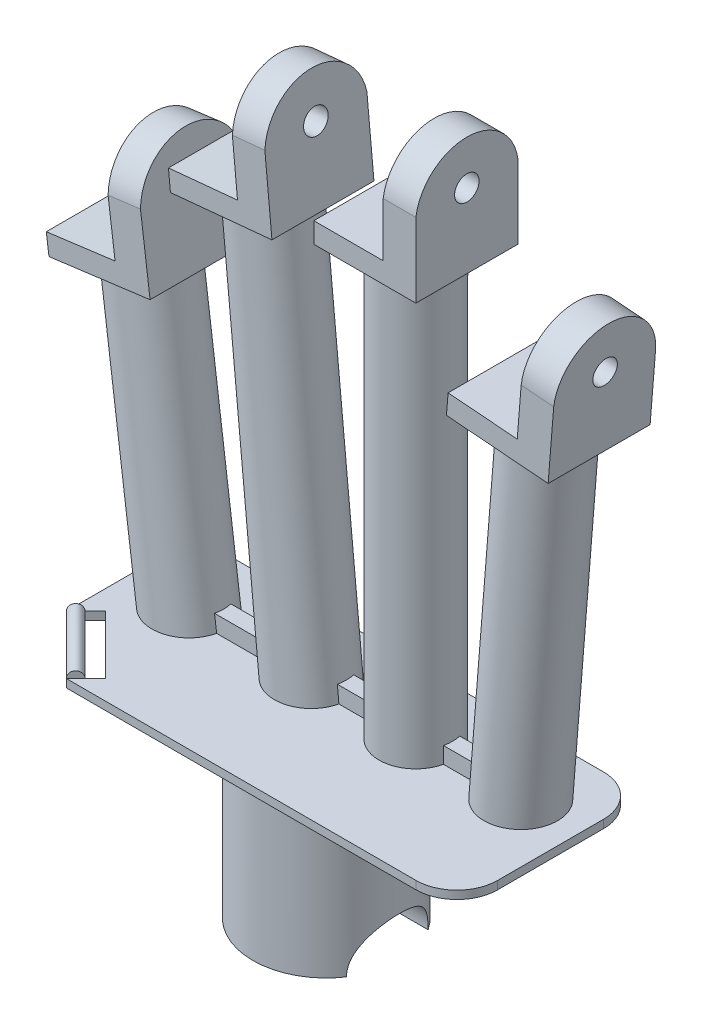
from build123d import *
from build123d.topology import SkipClean

# Parameters (mm, degrees)
BOSS_EXTRUDE1_DEPTH       = 2
CUT_EXTRUDE4_DEPTH        = 10
SKETCH6_W                 = 2
SKETCH6_H                 = 14.5
CUT_EXTRUDE5_DEPTH        = 10
SKETCH7_W                 = 12.5
SKETCH7_H                 = 12.5
BOSS_EXTRUDE2_DEPTH       = 2.5
SKETCH8_W                 = 2
SKETCH8_H                 = 2
BOSS_EXTRUDE3_DEPTH       = 41.5
CUT_EXTRUDE6_DEPTH        = 41.5
SKETCH10_W                = 2
SKETCH10_H                = 2
BOSS_EXTRUDE4_DEPTH       = 50.5
CUT_EXTRUDE7_DEPTH        = 50.5
SKETCH12_W                = 12.5
SKETCH12_H                = 12.5
BOSS_EXTRUDE5_DEPTH       = 2.5
CUT_EXTRUDE8_DEPTH        = 60.477411679
CUT_EXTRUDE8_DEPTH_BACK   = 2.5
SKETCH14_W                = 12.5
SKETCH14_H                = 12.5
BOSS_EXTRUDE6_DEPTH       = 2.5
SKETCH15_W                = 2
SKETCH15_H                = 2
BOSS_EXTRUDE7_DEPTH       = 39.5
SKETCH16_W                = 12.5
SKETCH16_H                = 12.5
BOSS_EXTRUDE8_DEPTH       = 2.5
SKETCH17_W                = 2
SKETCH17_H                = 12.5
BOSS_EXTRUDE9_DEPTH       = 2.5
SKETCH18_W                = 2
SKETCH18_H                = 12.5
CUT_EXTRUDE9_DEPTH        = 13.5
SKETCH19_W                = 2
SKETCH19_H                = 2
BOSS_EXTRUDE10_DEPTH      = 7.5
CUT_EXTRUDE11_DEPTH       = 33.5
CUT_EXTRUDE12_DEPTH       = 33.5
SKETCH22_W                = 2
SKETCH22_H                = 2
BOSS_EXTRUDE11_DEPTH      = 35.5
BOSS_EXTRUDE13_DEPTH      = 4
BOSS_EXTRUDE14_DEPTH      = 4
BOSS_EXTRUDE15_DEPTH      = 4
BOSS_EXTRUDE16_DEPTH      = 4
SKETCH28_R                = 4.5
SKETCH28_W                = 2
SKETCH28_H                = 2
BOSS_EXTRUDE17_DEPTH      = 57
SKETCH29_R                = 4.5
SKETCH29_W                = 2
SKETCH29_H                = 2
BOSS_EXTRUDE18_DEPTH      = 57
SKETCH30_R                = 4.5
SKETCH30_W                = 2
SKETCH30_H                = 2
BOSS_EXTRUDE19_DEPTH      = 57
SKETCH31_R                = 4.5
SKETCH31_W                = 2
SKETCH31_H                = 2
BOSS_EXTRUDE20_DEPTH      = 57
SKETCH32_W                = 122.959633523
SKETCH32_H                = 42.81362782
CUT_EXTRUDE13_DEPTH       = 57
BOSS_EXTRUDE21_DEPTH      = 1
CUT_EXTRUDE14_DEPTH       = 8
CUT_EXTRUDE15_DEPTH       = 8
CUT_EXTRUDE16_DEPTH       = 8
CUT_EXTRUDE17_DEPTH       = 8
BOSS_EXTRUDE22_DEPTH      = 1
BOSS_EXTRUDE23_DEPTH      = 2
BOSS_EXTRUDE23_DEPTH_BACK = 2
BOSS_EXTRUDE24_DEPTH      = 4
BOSS_EXTRUDE25_DEPTH      = 12.5
CUT_EXTRUDE18_DEPTH       = 12.5
SKETCH43_W                = 16
SKETCH43_H                = 2
CUT_EXTRUDE19_DEPTH       = 8.5
SKETCH44_R                = 1.5
CUT_EXTRUDE20_DEPTH       = 8.5
SKETCH45_R                = 9
BOSS_EXTRUDE27_DEPTH      = 20
CUT_EXTRUDE23_START       = -30
SKETCH50_R                = 9
CUT_EXTRUDE23_DEPTH       = 65
CUT_EXTRUDE24_DEPTH       = 65
CUT_EXTRUDE24_DEPTH_BACK  = 65
SKETCH52_W                = 56.65762051
SKETCH52_H                = 44.736687233
CUT_EXTRUDE25_DEPTH       = 65
CUT_EXTRUDE25_DEPTH_BACK  = 65
CUT_EXTRUDE26_DEPTH       = 65
CUT_EXTRUDE26_DEPTH_BACK  = 65
SKETCH56_R                = 43.614088274
SKETCH56_R_2              = 5
SKETCH57_R                = 5
CUT_EXTRUDE27_DEPTH       = 65
CUT_EXTRUDE28_DEPTH       = 17
CUT_EXTRUDE28_DEPTH_BACK  = 38
SKETCH58_R                = 5
CUT_EXTRUDE29_DEPTH       = 38
CUT_EXTRUDE30_DEPTH       = 38
CUT_EXTRUDE30_DEPTH_BACK  = 38
CUT_EXTRUDE31_DEPTH       = 38
CUT_EXTRUDE31_DEPTH_BACK  = 38
SKETCH61_W                = 51.924996509
SKETCH61_H                = 129.765980517
SKETCH61_W_2              = 87.26427603
SKETCH61_H_2              = 70.94781342
CUT_EXTRUDE32_DEPTH       = 38
CUT_EXTRUDE32_DEPTH_BACK  = 38
SKETCH62_W                = 45.730105884
SKETCH62_H                = 47.620660458
SKETCH63_W                = 49.77831918
SKETCH63_H                = 37.549123937
CUT_EXTRUDE33_DEPTH       = 38
CUT_EXTRUDE34_DEPTH       = 10
CUT_EXTRUDE34_DEPTH_BACK  = 23
SKETCH64_R                = 5
BOSS_EXTRUDE28_START      = -1.2
BOSS_EXTRUDE28_DEPTH      = 10.1
BOSS_EXTRUDE30_DEPTH      = 10.1
SKETCH67_W                = 0.773681874
SKETCH67_H                = 1.279774778
CUT_EXTRUDE35_DEPTH       = 10.1
CUT_EXTRUDE38_DEPTH       = 6
CUT_EXTRUDE38_DEPTH_BACK  = 6
CUT_EXTRUDE38_START       = -20
CUT_EXTRUDE44_DEPTH       = 28
CUT_EXTRUDE44_DEPTH_BACK  = 28
SKETCH73_R                = 0.815
BOSS_EXTRUDE31_DEPTH      = 10.1
CUT_EXTRUDE45_DEPTH       = 10.1


with BuildPart() as part:
    # Sketch4 → Boss-Extrude1 (new body)
    with BuildSketch(Plane.XY):
        Polygon((-2, 0), (-9, 0), (-15.226290525, 65), (-17.226290525, 65), (-11, 0), (-18, 0), (-24.539432883, 50), (-26.539432883, 50), (-20, 0), (-26, 0), (-26, -2), (15, -2), (15, 0), (9, 0), (13.425952869, 55), (11.425952869, 55), (7, 0), (0, 0), (0, 65), (-2, 65), align=None)
    extrude(amount=BOSS_EXTRUDE1_DEPTH)

    # Sketch5 → Cut-Extrude4 (cut)
    with BuildSketch(Plane.XY.offset(2)):
        Polygon((9.37564634, 55.872220493), (11.411691477, 54.822777915), (13.398823363, 54.662869695), (21.924639112, 53.976781356), (22.692490212, 57.613912627), (5.524505056, 72.3940809), (-16.325209023, 68.104380376), (-29.665618302, 62.849218827), (-29.083331676, 48.976254453), (-26.450573674, 49.320589338), (-24.484209654, 49.577767448), (-21.099856707, 50.020402427), (-24.484209654, 55.686609511), (-20.205422124, 64.224167275), (-17.179736544, 64.513994928), (-15.197920791, 64.703831246), (-10.585008306, 65.145697912), (2.587624418, 67.202095486), align=None)
    extrude(amount=-CUT_EXTRUDE4_DEPTH, mode=Mode.SUBTRACT)

    # Sketch6 → Cut-Extrude5 (cut)
    with BuildSketch(Plane.XY.offset(2)):
        Polygon((-22.603788855, 35.200214888), (-24.484209654, 49.577767448), (-26.450573674, 49.320589338), (-24.570152875, 34.943036778), align=None)
        Polygon((-13.815307691, 50.26989966), (-15.197920791, 64.703831246), (-17.179736544, 64.513994928), (-15.797123444, 50.080063343), align=None)
        with Locations((-1, 57.75)):
            Rectangle(SKETCH6_W, SKETCH6_H)
        Polygon((13.398823363, 54.662869695), (11.411691477, 54.822777915), (10.248609178, 40.369500101), (12.235741065, 40.209591881), align=None)
    extrude(amount=-CUT_EXTRUDE5_DEPTH, mode=Mode.SUBTRACT)

    # Sketch7 → Boss-Extrude2 (add)
    with BuildSketch(Plane(origin=(0, 50.5, 0), x_dir=(1, 0, 0), z_dir=(0, 1, 0))):
        with Locations((-1, -1)):
            Rectangle(SKETCH7_W, SKETCH7_H)
    extrude(amount=BOSS_EXTRUDE2_DEPTH)

    # Sketch8 → Boss-Extrude3 (add)
    with BuildSketch(Plane(origin=(3.293647576, 40.929178869, 0), x_dir=(0.9967777802722212, -0.08021257230374512, 0), z_dir=(0.08021257230374512, 0.9967777802722212, 0))):
        with Locations((11.977444462, -1)):
            Rectangle(SKETCH8_W, SKETCH8_H)
    extrude(amount=-BOSS_EXTRUDE3_DEPTH)

    # Sketch9 → Cut-Extrude6 (cut)
    with BuildSketch(Plane.XY.offset(2)):
        Polygon((7, 0), (9, 0), (12.235741065, 40.209591881), (10.248609178, 40.369500101), align=None)
    extrude(amount=-CUT_EXTRUDE6_DEPTH, mode=Mode.SUBTRACT)

    # Sketch10 → Boss-Extrude4 (add)
    with BuildSketch(Plane(origin=(-4.897136804, 51.124163089, 0), x_dir=(0.995443557626006, 0.09535262755100443, 0), z_dir=(-0.09535262755100443, 0.995443557626006, 0))):
        with Locations((-13.958992019, -1)):
            Rectangle(SKETCH10_W, SKETCH10_H)
    extrude(amount=-BOSS_EXTRUDE4_DEPTH)

    # Sketch11 → Cut-Extrude7 (cut)
    with BuildSketch(Plane.XY.offset(2)):
        Polygon((-11, 0), (-9, 0), (-13.815307691, 50.26989966), (-15.797123444, 50.080063343), align=None)
    extrude(amount=-CUT_EXTRUDE7_DEPTH, mode=Mode.SUBTRACT)

    # Sketch12 → Boss-Extrude5 (add)
    with BuildSketch(Plane(origin=(3.293647576, 40.929178869, 0), x_dir=(0.9967777802722212, -0.08021257230374557, 0), z_dir=(0.08021257230374557, 0.9967777802722213, 0))):
        with Locations((11.977444462, -1)):
            Rectangle(SKETCH12_W, SKETCH12_H)
    extrude(amount=BOSS_EXTRUDE5_DEPTH)

    # Sketch13 → Cut-Extrude8 (cut, two sides: drawn at the far end of the back side and taken through both)
    with BuildSketch(Plane.XY.offset(2).offset(-CUT_EXTRUDE8_DEPTH_BACK)):
        Polygon((-17.606376667, 47.897602035), (-17.797081922, 49.88848915), (-19.787969037, 49.697783895), (-19.637893395, 48.131053798), (-19.615531264, 47.897602035), (-19.597263782, 47.70689678), align=None)
    extrude(amount=CUT_EXTRUDE8_DEPTH + CUT_EXTRUDE8_DEPTH_BACK, mode=Mode.SUBTRACT)

    # Sketch14 → Boss-Extrude6 (add)
    with BuildSketch(Plane(origin=(-4.706431548, 49.133275974, 0), x_dir=(0.995443557626006, 0.0953526275510043, 0), z_dir=(-0.0953526275510043, 0.995443557626006, 0))):
        with Locations((-13.958992019, -1)):
            Rectangle(SKETCH14_W, SKETCH14_H)
    extrude(amount=BOSS_EXTRUDE6_DEPTH)



with BuildPart() as body_2:
    # Sketch15 → Boss-Extrude7 (new body)
    with BuildSketch(Plane(origin=(-4.906512673, 37.514817884, 0), x_dir=(0.9915553489661718, 0.12968419308679568, 0), z_dir=(-0.12968419308679568, 0.9915553489661719, 0))):
        with Locations((-30.847996281, -1)):
            Rectangle(SKETCH15_W, SKETCH15_H)
    extrude(amount=-BOSS_EXTRUDE7_DEPTH)

    # Sketch16 → Boss-Extrude8 (add)
    with BuildSketch(Plane(origin=(-4.906512673, 37.514817884, 0), x_dir=(0.9915553489661718, 0.1296841930867958, 0), z_dir=(-0.1296841930867958, 0.9915553489661719, 0))):
        with Locations((-30.847996281, -1)):
            Rectangle(SKETCH16_W, SKETCH16_H)
    extrude(amount=BOSS_EXTRUDE8_DEPTH)

    # Sketch17 → Boss-Extrude9 (add)
    with BuildSketch(Plane(origin=(-5.230723156, 39.993706257, 0), x_dir=(0.9915553489661718, 0.12968419308679563, 0), z_dir=(-0.12968419308679563, 0.9915553489661718, 0))):
        with Locations((-23.597996281, -1)):
            Rectangle(SKETCH17_W, SKETCH17_H)
    extrude(amount=-BOSS_EXTRUDE9_DEPTH)

    # Sketch18 → Cut-Extrude9 (cut)
    with BuildSketch(Plane(origin=(-5.230723156, 39.993706257, 0), x_dir=(0.9915553489661718, 0.12968419308679563, 0), z_dir=(-0.12968419308679563, 0.9915553489661718, 0))):
        with Locations((-36.097996281, -1)):
            Rectangle(SKETCH18_W, SKETCH18_H)
    extrude(amount=-CUT_EXTRUDE9_DEPTH, mode=Mode.SUBTRACT)


with BuildPart() as part_1:
    add(part.part)

    add(body_2.part)  # Boss-Extrude10 merges body 2
    # Sketch19 → Boss-Extrude10 (add)
    with BuildSketch(Plane.ZY.offset(26)):
        with Locations((1, -1)):
            Rectangle(SKETCH19_W, SKETCH19_H)
    extrude(amount=BOSS_EXTRUDE10_DEPTH)

    # Sketch20 → Cut-Extrude11 (cut)
    with BuildSketch(Plane.XY.offset(2)):
        Polygon((-31.857654672, -2), (-29.840621531, -2), (-29.379927415, -5.522431713), (-31.363038113, -5.781800099), align=None)
        Polygon((-20, 0), (-18, 0), (-22.603788855, 35.200214888), (-24.570152875, 34.943036778), align=None)
    extrude(amount=-CUT_EXTRUDE11_DEPTH, mode=Mode.SUBTRACT)

    # Sketch21 → Cut-Extrude12 (cut)
    with BuildSketch(Plane.XY.offset(2)):
        Polygon((-36.48556374, 33.384636185), (-34.502453042, 33.644004571), (-30.102198846, 0), (-32.119231987, 0), align=None)
    extrude(amount=-CUT_EXTRUDE12_DEPTH, mode=Mode.SUBTRACT)


with BuildPart() as cut_extrude12_piece_1:
    # of the separate pieces the step leaves, piece 1, a body of its own (cut_extrude12_pieces)
    add(part_1.part.solids().sort_by_distance((-15.027463791, 0, 0))[0])



with BuildPart() as cut_extrude12_piece_2:
    # of the separate pieces the step leaves, piece 2, a body of its own (cut_extrude12_pieces)
    add(part_1.part.solids().sort_by_distance((-40.032329107, 35.44205093, -5.25))[0])


with BuildPart() as cut_extrude12_piece_1_1:
    add(cut_extrude12_piece_1.part)

    add(cut_extrude12_piece_2.part)  # Boss-Extrude11 merges Cut-Extrude12 piece 2
    # Sketch22 → Boss-Extrude11 (add)
    with BuildSketch(Plane(origin=(-4.906512673, 37.514817884, 0), x_dir=(-0.9915553489661718, -0.12968419308679563, 0), z_dir=(0.12968419308679563, -0.9915553489661718, 0))):
        with Locations((28.847996281, -1)):
            Rectangle(SKETCH22_W, SKETCH22_H)
    extrude(amount=BOSS_EXTRUDE11_DEPTH)

    # Sketch24 → Boss-Extrude13 (add)
    with BuildSketch(Plane(origin=(18.168711631, -1.462070207, 0), x_dir=(0, 0, -1), z_dir=(0.9967777802722213, -0.08021257230374557, 0))):
        with BuildLine():
            Line((5.25, 43.561488006), (5.25, 49.561488006))
            ThreePointArc((5.25, 49.561488006), (-1, 55.538239219), (-7.25, 49.561488006))
            Line((-7.25, 49.561488006), (-7.25, 43.561488006))
            Line((-7.25, 43.561488006), (5.25, 43.561488006))
        make_face()
    extrude(amount=-BOSS_EXTRUDE13_DEPTH)

    # Sketch25 → Boss-Extrude14 (add)
    with BuildSketch(Plane(origin=(5.25, 0, 0), x_dir=(0, 0, -1), z_dir=(1, 0, 0))):
        with BuildLine():
            Line((-7.25, 53), (5.25, 53))
            Line((5.25, 53), (5.25, 59.612068966))
            ThreePointArc((5.25, 59.612068966), (-1, 65), (-7.25, 59.612068966))
            Line((-7.25, 59.612068966), (-7.25, 53))
        make_face()
    extrude(amount=-BOSS_EXTRUDE14_DEPTH)

    # Sketch26 → Boss-Extrude15 (add)
    with BuildSketch(Plane(origin=(-7.673866441, -0.735072645, 0), x_dir=(0, 0, -1), z_dir=(0.995443557626006, 0.0953526275510043, 0))):
        with BuildLine():
            Line((-7.25, 51.858173648), (5.25, 51.858173648))
            Line((5.25, 51.858173648), (5.25, 58.470242613))
            ThreePointArc((5.25, 58.470242613), (-1, 63.858173648), (-7.25, 58.470242613))
            Line((-7.25, 58.470242613), (-7.25, 51.858173648))
        make_face()
    extrude(amount=-BOSS_EXTRUDE15_DEPTH)

    # Sketch27 → Boss-Extrude16 (add)
    with BuildSketch(Plane(origin=(-22.407164089, -2.930602913, 0), x_dir=(0, 0, -1), z_dir=(0.9915553489661718, 0.12968419308679563, 0))):
        with BuildLine():
            Line((-7.25, 40.334315476), (5.25, 40.334315476))
            Line((5.25, 40.334315476), (5.25, 46.946384441))
            ThreePointArc((5.25, 46.946384441), (-1, 52.334315476), (-7.25, 46.946384441))
            Line((-7.25, 46.946384441), (-7.25, 40.334315476))
        make_face()
    extrude(amount=-BOSS_EXTRUDE16_DEPTH)

    # Sketch28 → Boss-Extrude17 (add)
    with BuildSketch(Plane(origin=(0, 50.5, 0), x_dir=(-1, 0, 0), z_dir=(0, -1, 0))):
        with Locations((1, -1)):
            Circle(SKETCH28_R)
        with Locations((1, -1)):
            Rectangle(SKETCH28_W, SKETCH28_H, mode=Mode.SUBTRACT)
    extrude(amount=BOSS_EXTRUDE17_DEPTH)

    # Sketch29 → Boss-Extrude18 (add)
    with BuildSketch(Plane(origin=(-4.706431548, 49.133275974, 0), x_dir=(-0.995443557626006, -0.09535262755100447, 0), z_dir=(0.09535262755100449, -0.9954435576260061, 0))):
        with Locations((13.958992019, -1)):
            Circle(SKETCH29_R)
        with Locations((13.958992019, -1)):
            Rectangle(SKETCH29_W, SKETCH29_H, mode=Mode.SUBTRACT)
    extrude(amount=BOSS_EXTRUDE18_DEPTH)

    # Sketch30 → Boss-Extrude19 (add)
    with BuildSketch(Plane(origin=(-4.906512673, 37.514817884, 0), x_dir=(0.9915553489661718, 0.12968419308679563, 0), z_dir=(0.12968419308679563, -0.9915553489661718, 0))):
        with Locations((-28.847996281, 1)):
            Circle(SKETCH30_R)
        with Locations((-28.847996281, 1)):
            Rectangle(SKETCH30_W, SKETCH30_H, mode=Mode.SUBTRACT)
    extrude(amount=BOSS_EXTRUDE19_DEPTH)

    # Sketch31 → Boss-Extrude20 (add)
    with BuildSketch(Plane(origin=(3.293647576, 40.929178869, 0), x_dir=(-0.9967777802722212, 0.08021257230374572, 0), z_dir=(-0.0802125723037457, -0.9967777802722211, 0))):
        with Locations((-11.977444462, -1)):
            Circle(SKETCH31_R)
        with Locations((-11.977444462, -1)):
            Rectangle(SKETCH31_W, SKETCH31_H, mode=Mode.SUBTRACT)
    extrude(amount=BOSS_EXTRUDE20_DEPTH)

    # Sketch32 → Cut-Extrude13 (cut)
    with BuildSketch(Plane.XZ.offset(2)):
        with Locations((-20.029572383, 0.792189378)):
            Rectangle(SKETCH32_W, SKETCH32_H)
    extrude(amount=CUT_EXTRUDE13_DEPTH, mode=Mode.SUBTRACT)

    # Sketch33 → Boss-Extrude21 (add)
    with BuildSketch(Plane(origin=(0, -2, 0), x_dir=(-1, 0, 0), z_dir=(0, -1, 0))):
        with BuildLine():
            Line((-14.023148824, -9), (30.976851176, -9))
            ThreePointArc((30.976851176, -9), (34.512385082, -7.535533906), (35.976851176, -4))
            Line((35.976851176, -4), (35.976851176, 2))
            ThreePointArc((35.976851176, 2), (34.512385082, 5.535533906), (30.976851176, 7))
            Line((30.976851176, 7), (-14.023148824, 7))
            ThreePointArc((-14.023148824, 7), (-17.55868273, 5.535533906), (-19.023148824, 2))
            Line((-19.023148824, 2), (-19.023148824, -4))
            ThreePointArc((-19.023148824, -4), (-17.55868273, -7.535533906), (-14.023148824, -9))
        make_face()
    extrude(amount=BOSS_EXTRUDE21_DEPTH)

    # Sketch34 → Cut-Extrude14 (cut)
    with BuildSketch(Plane(origin=(-26.373385485, -3.449339685, 0), x_dir=(0, 0, 1), z_dir=(-0.9915553489661718, -0.12968419308679557, 0))):
        with BuildLine():
            ThreePointArc((1, 45.434315476), (2.060660172, 45.873655304), (2.5, 46.934315476))
            ThreePointArc((2.5, 46.934315476), (-0.060660172, 47.994975647), (1, 45.434315476))
        make_face()
    extrude(amount=-CUT_EXTRUDE14_DEPTH, mode=Mode.SUBTRACT)

    # Sketch35 → Cut-Extrude15 (cut)
    with BuildSketch(Plane(origin=(-11.655640671, -1.116483155, 0), x_dir=(0, 0, 1), z_dir=(-0.995443557626006, -0.09535262755100442, 0))):
        with BuildLine():
            ThreePointArc((1, 56.958173648), (2.060660172, 57.397513476), (2.5, 58.458173648))
            ThreePointArc((2.5, 58.458173648), (-0.060660172, 59.51883382), (1, 56.958173648))
        make_face()
    extrude(amount=-CUT_EXTRUDE15_DEPTH, mode=Mode.SUBTRACT)

    # Sketch36 → Cut-Extrude16 (cut)
    with BuildSketch(Plane.ZY.offset(-1.25)):
        with BuildLine():
            ThreePointArc((1, 58.1), (2.060660172, 58.539339828), (2.5, 59.6))
            ThreePointArc((2.5, 59.6), (-0.060660172, 60.660660172), (1, 58.1))
        make_face()
    extrude(amount=-CUT_EXTRUDE16_DEPTH, mode=Mode.SUBTRACT)

    # Sketch37 → Cut-Extrude17 (cut)
    with BuildSketch(Plane(origin=(14.18160051, -1.141219918, 0), x_dir=(0, 0, 1), z_dir=(-0.9967777802722212, 0.08021257230374561, 0))):
        with BuildLine():
            ThreePointArc((1, 48.661488006), (2.060660172, 49.100827834), (2.5, 50.161488006))
            ThreePointArc((2.5, 50.161488006), (-0.060660172, 51.222148178), (1, 48.661488006))
        make_face()
    extrude(amount=-CUT_EXTRUDE17_DEPTH, mode=Mode.SUBTRACT)

    # Sketch38 → Boss-Extrude22 (add)
    with BuildSketch(Plane(origin=(0, -3, 0), x_dir=(-1, 0, 0), z_dir=(0, -1, 0))):
        with BuildLine():
            ThreePointArc((-14.023148824, -9), (-17.55868273, -7.535533906), (-19.023148824, -4))
            Line((-19.023148824, -4), (-19.023148824, -11))
            ThreePointArc((-19.023148824, -11), (-17.55868273, -14.535533906), (-14.023148824, -16))
            Line((-14.023148824, -16), (30.976851176, -16))
            ThreePointArc((30.976851176, -16), (34.512385082, -14.535533906), (35.976851176, -11))
            Line((35.976851176, -11), (35.976851176, -4))
            ThreePointArc((35.976851176, -4), (34.512385082, -7.535533906), (30.976851176, -9))
            Line((30.976851176, -9), (-14.023148824, -9))
        make_face()
    extrude(amount=-BOSS_EXTRUDE22_DEPTH)



with BuildPart() as body_2_2:
    # Sketch39 → Boss-Extrude23 (new, two sides: drawn at the far end of the back side and taken through both)
    with BuildSketch(Plane(origin=(0, -2, 0), x_dir=(1, 0, 0), z_dir=(0, 1, 0)).offset(-BOSS_EXTRUDE23_DEPTH_BACK)):
        Polygon((-30.0929677, -18.954951288), (-34.512385082, -14.535533906), (-38.931802465, -10.116116524), (-47.770637229, -18.954951288), (-39.165158063, -28.027141652), align=None)
    extrude(amount=BOSS_EXTRUDE23_DEPTH + BOSS_EXTRUDE23_DEPTH_BACK)


with BuildPart() as cut_extrude12_piece_1_2:
    add(cut_extrude12_piece_1_1.part)

    add(body_2_2.part)  # Boss-Extrude24 merges body 2 2
    # Sketch40 → Boss-Extrude24 (add)
    with BuildSketch(Plane(origin=(0, 0, 0), x_dir=(1, 0, 0), z_dir=(0, 1, 0))):
        Polygon((-35.976851176, -8.888761514), (-38.931802465, -10.116116524), (-30.0929677, -18.954951288), (-28.86561269, -16), align=None)
        Polygon((-39.165158063, -28.027141652), (-47.770637229, -18.954951288), (-50.245510964, -21.429825023), (-41.406676199, -30.268659787), align=None)
    extrude(amount=-BOSS_EXTRUDE24_DEPTH)

    # Sketch41 → Boss-Extrude25 (add)
    with BuildSketch(Plane(origin=(0, -2, 0), x_dir=(1, 0, 0), z_dir=(0, 1, 0))):
        Polygon((-44.235103323, -27.440232663), (-41.406676199, -30.268659787), (-32.567841434, -21.429825023), (-35.396268559, -18.601397898), align=None)
    extrude(amount=BOSS_EXTRUDE25_DEPTH)

    # Sketch42 → Cut-Extrude18 (cut)
    with BuildSketch(Plane(origin=(-8.39743533, 0, -8.39743533), x_dir=(-0.7071067811865478, 0, 0.7071067811865472), z_dir=(-0.7071067811865472, 0, -0.7071067811865478))):
        with BuildLine():
            ThreePointArc((50.68211612, 5.25), (44.43211612, 10.5), (38.18211612, 5.25))
            ThreePointArc((38.18211612, 5.25), (44.43211612, 16.808543829), (50.68211612, 5.25))
        make_face()
    extrude(amount=-CUT_EXTRUDE18_DEPTH, mode=Mode.SUBTRACT)

    # Sketch43 → Cut-Extrude19 (cut)
    with BuildSketch(Plane(origin=(-14.407842971, 0, -14.407842971), x_dir=(-0.7071067811865479, 0, 0.7071067811865472), z_dir=(-0.7071067811865472, 0, -0.7071067811865479))):
        with Locations((42.68211612, -1)):
            Rectangle(SKETCH43_W, SKETCH43_H)
    extrude(amount=-CUT_EXTRUDE19_DEPTH, mode=Mode.SUBTRACT)

    # Sketch44 → Cut-Extrude20 (cut)
    with BuildSketch(Plane(origin=(-8.39743533, 0, -8.39743533), x_dir=(-0.7071067811865478, 0, 0.7071067811865472), z_dir=(-0.7071067811865472, 0, -0.7071067811865478))):
        with Locations((44.43211612, 4.6)):
            Circle(SKETCH44_R)
    extrude(amount=-CUT_EXTRUDE20_DEPTH, mode=Mode.SUBTRACT)

    # Sketch45 → Boss-Extrude27 (add)
    with BuildSketch(Plane(origin=(0, -3, 0), x_dir=(-1, 0, 0), z_dir=(0, -1, 0))):
        with Locations((8.476851176, -4.5)):
            Circle(SKETCH45_R)
    extrude(amount=BOSS_EXTRUDE27_DEPTH)


with BuildPart() as body_2_3:
    # Sketch46 → Revolve1 (revolve)
    with BuildSketch(Plane.XY):
        with BuildLine():
            Line((-8.476851176, -45.826430986), (-8.476851176, -89.289265837))
            ThreePointArc((-8.476851176, -89.289265837), (13.254566249, -67.557848412), (-8.476851176, -45.826430986))
        make_face()
    revolve(axis=Axis((-8.476851176, -45.826430986, 0), (0, -1, 0)))

    # Sketch50 → Cut-Extrude23 (cut)
    with BuildSketch(Plane(origin=(0, 0, 0), x_dir=(1, 0, 0), z_dir=(0, 1, 0)).offset(CUT_EXTRUDE23_START)):
        with Locations((-8.476851176, 0)):
            Circle(SKETCH50_R)
    extrude(amount=-CUT_EXTRUDE23_DEPTH, mode=Mode.SUBTRACT)

    # Sketch52 → Cut-Extrude24 (cut, two sides: drawn at the far end of the back side and taken through both)
    with BuildSketch(Plane(origin=(0, 0, 0), x_dir=(0, 0, -1), z_dir=(1, 0, 0)).offset(-CUT_EXTRUDE24_DEPTH_BACK)):
        with Locations((0, -67.557848412)):
            Rectangle(SKETCH52_W, SKETCH52_H)
        Polygon((-10.161758641, -47.777694132), (0, -47.777694132), (10.161758641, -47.777694132), (10.161758641, -87.338002691), (0, -87.338002691), (-10.161758641, -87.338002691), align=None, mode=Mode.SUBTRACT)
    extrude(amount=CUT_EXTRUDE24_DEPTH + CUT_EXTRUDE24_DEPTH_BACK, mode=Mode.SUBTRACT)

    # Sketch57 → Cut-Extrude27 (cut)
    with BuildSketch(Plane.XY.offset(10.161758641)):
        with Locations((-8.476851176, -67.557848412)):
            Circle(SKETCH57_R)
    extrude(amount=-CUT_EXTRUDE27_DEPTH, mode=Mode.SUBTRACT)

    # Sketch59 → Cut-Extrude29 (cut)
    with BuildSketch(Plane.XY.offset(10.161758641)):
        Polygon((-2.226851176, -67.557848412), (-2.226851176, -73.807848412), (-14.726851176, -73.807848412), (-14.726851176, -67.557848412), (-40.012372079, -67.557848412), (-40.012372079, -94.995810902), (23.058669727, -94.995810902), (23.058669727, -67.557848412), align=None)
    extrude(amount=-CUT_EXTRUDE29_DEPTH, mode=Mode.SUBTRACT)


with BuildPart() as body_3:
    # Sketch53 → Revolve2 (revolve)
    with BuildSketch(Plane(origin=(0, 0, 0), x_dir=(1, 0, 0), z_dir=(0, 1, 0))):
        with BuildLine():
            Line((-8.800357803, -28.92805964), (-8.800357803, -72.38805964))
            ThreePointArc((-8.800357803, -72.38805964), (-30.530357803, -50.65805964), (-8.800357803, -28.92805964))
        make_face()
    revolve(axis=Axis((-8.800357803, 0, 28.92805964), (0, 0, 1)))

    # Sketch54 → Cut-Extrude25 (cut, two sides: drawn at the far end of the back side and taken through both)
    with SkipClean():  # the faces are left unmerged after this step: merging them gives an invalid solid
        with BuildSketch(Plane(origin=(0, 0, 0), x_dir=(1, 0, 0), z_dir=(0, 1, 0)).offset(-CUT_EXTRUDE25_DEPTH_BACK)):
            with BuildLine():
                ThreePointArc((-18.960357803, -69.866581186), (-14.034463591, -71.748271507), (-8.800357803, -72.38805964))
                ThreePointArc((-8.800357803, -72.38805964), (-3.566252015, -71.748271507), (1.359642197, -69.866581186))
                Line((1.359642197, -69.866581186), (1.359642197, -31.449538093))
                ThreePointArc((1.359642197, -31.449538093), (-3.566252019, -29.567847772), (-8.80035781, -28.92805964))
                ThreePointArc((-8.80035781, -28.92805964), (-14.034463594, -29.567847773), (-18.960357803, -31.449538093))
                Line((-18.960357803, -31.449538093), (-18.960357803, -69.866581186))
            make_face()
        extrude(amount=CUT_EXTRUDE25_DEPTH + CUT_EXTRUDE25_DEPTH_BACK, mode=Mode.SUBTRACT)


with BuildPart() as cut_extrude25_piece_1:
    # of the separate pieces the step leaves, piece 1, a body of its own (cut_extrude25_pieces)
    add(body_3.part.solids().sort_by_distance((1.359642197, -2.431e-06, 31.449538093))[0])


with BuildPart() as cut_extrude25_piece_2:
    # of the separate pieces the step leaves, piece 2, a body of its own (cut_extrude25_pieces)
    add(body_3.part.solids().sort_by_distance((-18.960357803, 0, 69.866581186))[0])


with BuildPart() as body_5:
    # Sketch55 → Revolve3 (revolve)
    with BuildSketch(Plane.XY):
        with BuildLine():
            Line((67.523973483, -43.825779011), (67.523973483, -0.365779011))
            ThreePointArc((67.523973483, -0.365779011), (45.793973483, -22.095779011), (67.523973483, -43.825779011))
        make_face()
    revolve(axis=Axis((67.523973483, -43.825779011, 0), (0, 1, 0)))

    # Sketch56 → Cut-Extrude26 (cut, two sides: drawn at the far end of the back side and taken through both)
    with BuildSketch(Plane.XY.offset(-CUT_EXTRUDE26_DEPTH_BACK)):
        with Locations((67.523973483, -22.095779011)):
            Circle(SKETCH56_R)
        with Locations((67.523973483, -22.095779011)):
            Circle(SKETCH56_R_2, mode=Mode.SUBTRACT)
    extrude(amount=CUT_EXTRUDE26_DEPTH + CUT_EXTRUDE26_DEPTH_BACK, mode=Mode.SUBTRACT)


with BuildPart() as cut_extrude28_tool:
    # Sketch58 → Cut-Extrude28 (new, two sides: drawn at the far end of the back side and taken through both)
    with SkipClean():  # the faces are left unmerged after this step: merging them gives an invalid solid
        with BuildSketch(Plane(origin=(0, 0, 0), x_dir=(0, 0, -1), z_dir=(1, 0, 0)).offset(-CUT_EXTRUDE28_DEPTH_BACK)):
            with Locations((-50.65805964, 0)):
                Circle(SKETCH58_R)
        extrude(amount=CUT_EXTRUDE28_DEPTH + CUT_EXTRUDE28_DEPTH_BACK)


with BuildPart() as cut_extrude25_piece_1_1:
    with SkipClean():  # the faces are left unmerged after this step: merging them gives an invalid solid
        add(cut_extrude25_piece_1.part)

        # Cut-Extrude28: cut by cut_extrude28_tool
        add(cut_extrude28_tool.part, mode=Mode.SUBTRACT)


with BuildPart() as cut_extrude25_piece_2_1:
    with SkipClean():  # the faces are left unmerged after this step: merging them gives an invalid solid
        add(cut_extrude25_piece_2.part)

        # Cut-Extrude28: cut by cut_extrude28_tool
        add(cut_extrude28_tool.part, mode=Mode.SUBTRACT)


with BuildPart() as cut_extrude30_tool:
    # Sketch60 → Cut-Extrude30 (new, two sides: drawn at the far end of the back side and taken through both)
    with BuildSketch(Plane(origin=(-18.960357803, 0, 0), x_dir=(0, 0, -1), z_dir=(1, 0, 0)).offset(-CUT_EXTRUDE30_DEPTH_BACK)):
        Polygon((-26.705466863, -24.826098639), (-26.705466863, 0), (-44.40805964, 0), (-44.40805964, -6.25), (-56.90805964, -6.25), (-56.90805964, 0), (-74.610652417, 0), (-74.610652417, -24.826098639), align=None)
    extrude(amount=CUT_EXTRUDE30_DEPTH + CUT_EXTRUDE30_DEPTH_BACK)


with BuildPart() as cut_extrude12_piece_1_3:
    add(cut_extrude12_piece_1_2.part)

    # Cut-Extrude30: cut by cut_extrude30_tool
    add(cut_extrude30_tool.part, mode=Mode.SUBTRACT)

    # Sketch64 → Cut-Extrude34 (cut, two sides: drawn at the far end of the back side and taken through both)
    with BuildSketch(Plane(origin=(0, 0, 0), x_dir=(0, 0, -1), z_dir=(1, 0, 0)).offset(-CUT_EXTRUDE34_DEPTH_BACK)):
        with Locations((-4.5, -23)):
            Circle(SKETCH64_R)
    extrude(amount=CUT_EXTRUDE34_DEPTH + CUT_EXTRUDE34_DEPTH_BACK, mode=Mode.SUBTRACT)

    # Sketch65 → Boss-Extrude28 (add)
    with BuildSketch(Plane(origin=(-5.569008206, 0, -5.569008206), x_dir=(0.7071067811865481, 0, -0.707106781186547), z_dir=(0.707106781186547, 0, 0.7071067811865481)).offset(BOSS_EXTRUDE28_START)):
        with BuildLine():
            Line((-30.194450724, -1.191074576), (-30.194450724, 0))
            Line((-30.194450724, 0), (-34.68211612, 0))
            Line((-34.68211612, 0), (-34.68211612, -4))
            Line((-34.68211612, -4), (-30.194450724, -4))
            Line((-30.194450724, -4), (-30.194450724, -2.808925424))
            ThreePointArc((-30.194450724, -2.808925424), (-31.003376148, -2), (-30.194450724, -1.191074576))
        make_face()
    extrude(amount=-BOSS_EXTRUDE28_DEPTH)

    # Sketch66 → Boss-Extrude30 (add)
    with BuildSketch(Plane(origin=(-13.559314833, 0, -13.559314833), x_dir=(-0.707106781186548, 0, 0.7071067811865471), z_dir=(-0.7071067811865471, 0, -0.707106781186548))):
        with BuildLine():
            Line((30.194450724, -1.191074576), (30.194450724, -0.595537288))
            ThreePointArc((30.194450724, -0.595537288), (29.192202733, -1.010681999), (28.777058022, -2.012929989))
            ThreePointArc((28.777058022, -2.012929989), (29.192202733, -3.01517798), (30.194450724, -3.430322691))
            Line((30.194450724, -3.430322691), (30.194450724, -3))
            Line((30.194450724, -3), (30.194450724, -2.860645381))
            Line((30.194450724, -2.860645381), (30.194450724, -2.834785403))
            ThreePointArc((30.194450724, -2.834785403), (29.37259531, -2.012929989), (30.194450724, -1.191074576))
        make_face()
    extrude(amount=-BOSS_EXTRUDE30_DEPTH)

    # Sketch67 → Cut-Extrude35 (cut)
    with BuildSketch(Plane(origin=(-13.559314833, 0, -13.559314833), x_dir=(-0.707106781186548, 0, 0.7071067811865471), z_dir=(-0.7071067811865471, 0, -0.707106781186548))):
        with Locations((31.390217085, -2.639887389)):
            Rectangle(SKETCH67_W, SKETCH67_H)
    extrude(amount=CUT_EXTRUDE35_DEPTH, mode=Mode.SUBTRACT)

    # Sketch68 → Cut-Extrude38 (cut, two sides: drawn at the far end of the back side and taken through both)
    with BuildSketch(Plane(origin=(0, 0, 0), x_dir=(1, 0, 0), z_dir=(0, 1, 0)).offset(CUT_EXTRUDE38_START - CUT_EXTRUDE38_DEPTH_BACK)):
        Polygon((-9.976851176, -4.5), (-9.976851176, -6), (-6.976851176, -6), (-6.976851176, -3), (-9.976851176, -3), align=None)
    extrude(amount=CUT_EXTRUDE38_DEPTH + CUT_EXTRUDE38_DEPTH_BACK, mode=Mode.SUBTRACT)

    # Sketch70 → Cut-Extrude44 (cut, two sides: drawn at the far end of the back side and taken through both)
    with BuildSketch(Plane(origin=(0, -2, 0), x_dir=(1, 0, 0), z_dir=(0, 1, 0)).offset(-CUT_EXTRUDE44_DEPTH_BACK)):
        with BuildLine():
            Line((-26.766030916, -13.93095823), (-33.907809406, -6.78917974))
            Line((-33.907809406, -6.78917974), (-35.482012347, -8.363382681))
            ThreePointArc((-35.482012347, -8.363382681), (-51.57592667, -29.082653564), (-28.835072686, -16))
            Line((-28.835072686, -16), (-26.766030916, -13.93095823))
        make_face()
    extrude(amount=CUT_EXTRUDE44_DEPTH + CUT_EXTRUDE44_DEPTH_BACK, mode=Mode.SUBTRACT)

    # Sketch73 → Boss-Extrude31 (add)
    with BuildSketch(Plane(origin=(-6.417536343, 0, -6.417536343), x_dir=(-0.7071067811865459, 0, 0.7071067811865492), z_dir=(-0.7071067811865492, 0, -0.7071067811865459))):
        with Locations((30.888183931, -2)):
            Circle(SKETCH73_R)
    extrude(amount=BOSS_EXTRUDE31_DEPTH)

    # Sketch74 → Cut-Extrude45 (cut)
    with BuildSketch(Plane(origin=(0, -2, 0), x_dir=(1, 0, 0), z_dir=(0, 1, 0))):
        Polygon((-33.587044957, -6.468415291), (-33.907809406, -6.78917974), (-26.766030916, -13.93095823), (-26.445266467, -13.610193781), align=None)
    extrude(amount=-CUT_EXTRUDE45_DEPTH, mode=Mode.SUBTRACT)


with BuildPart() as cut_extrude25_piece_1_2:
    add(cut_extrude25_piece_1_1.part)

    # Cut-Extrude30: cut by cut_extrude30_tool
    add(cut_extrude30_tool.part, mode=Mode.SUBTRACT)

    # Sketch63 → Cut-Extrude33 (cut)
    with BuildSketch(Plane.ZY.offset(-1.359642197)):
        with Locations((50.908942192, 8.899479354)):
            Rectangle(SKETCH63_W, SKETCH63_H)
    extrude(amount=-CUT_EXTRUDE33_DEPTH, mode=Mode.SUBTRACT)


with BuildPart() as cut_extrude25_piece_2_2:
    add(cut_extrude25_piece_2_1.part)

    # Cut-Extrude30: cut by cut_extrude30_tool
    add(cut_extrude30_tool.part, mode=Mode.SUBTRACT)

    # Sketch62 → Cut-Extrude32 (cut, two sides: drawn at the far end of the back side and taken through both)
    with BuildSketch(Plane(origin=(0, 0, 0), x_dir=(0, 0, -1), z_dir=(1, 0, 0)).offset(-CUT_EXTRUDE32_DEPTH_BACK)):
        with Locations((-53.688412102, 1.73866597)):
            Rectangle(SKETCH62_W, SKETCH62_H)
    extrude(amount=CUT_EXTRUDE32_DEPTH + CUT_EXTRUDE32_DEPTH_BACK, mode=Mode.SUBTRACT)


with BuildPart() as cut_extrude31_tool:
    # Sketch61 → Cut-Extrude31 (new, two sides: drawn at the far end of the back side and taken through both)
    with BuildSketch(Plane.XY.offset(-CUT_EXTRUDE31_DEPTH_BACK)):
        with Locations((62.818509123, 4.671784008)):
            Rectangle(SKETCH61_W, SKETCH61_H)
        with Locations((-12.50986863, -70.171035463)):
            Rectangle(SKETCH61_W_2, SKETCH61_H_2)
    extrude(amount=CUT_EXTRUDE31_DEPTH + CUT_EXTRUDE31_DEPTH_BACK)


with BuildPart() as body_2_3_1:
    add(body_2_3.part)

    # Cut-Extrude31: cut by cut_extrude31_tool
    add(cut_extrude31_tool.part, mode=Mode.SUBTRACT)


with BuildPart() as body_5_1:
    add(body_5.part)

    # Cut-Extrude31: cut by cut_extrude31_tool
    add(cut_extrude31_tool.part, mode=Mode.SUBTRACT)


solid = cut_extrude12_piece_1_3.part
